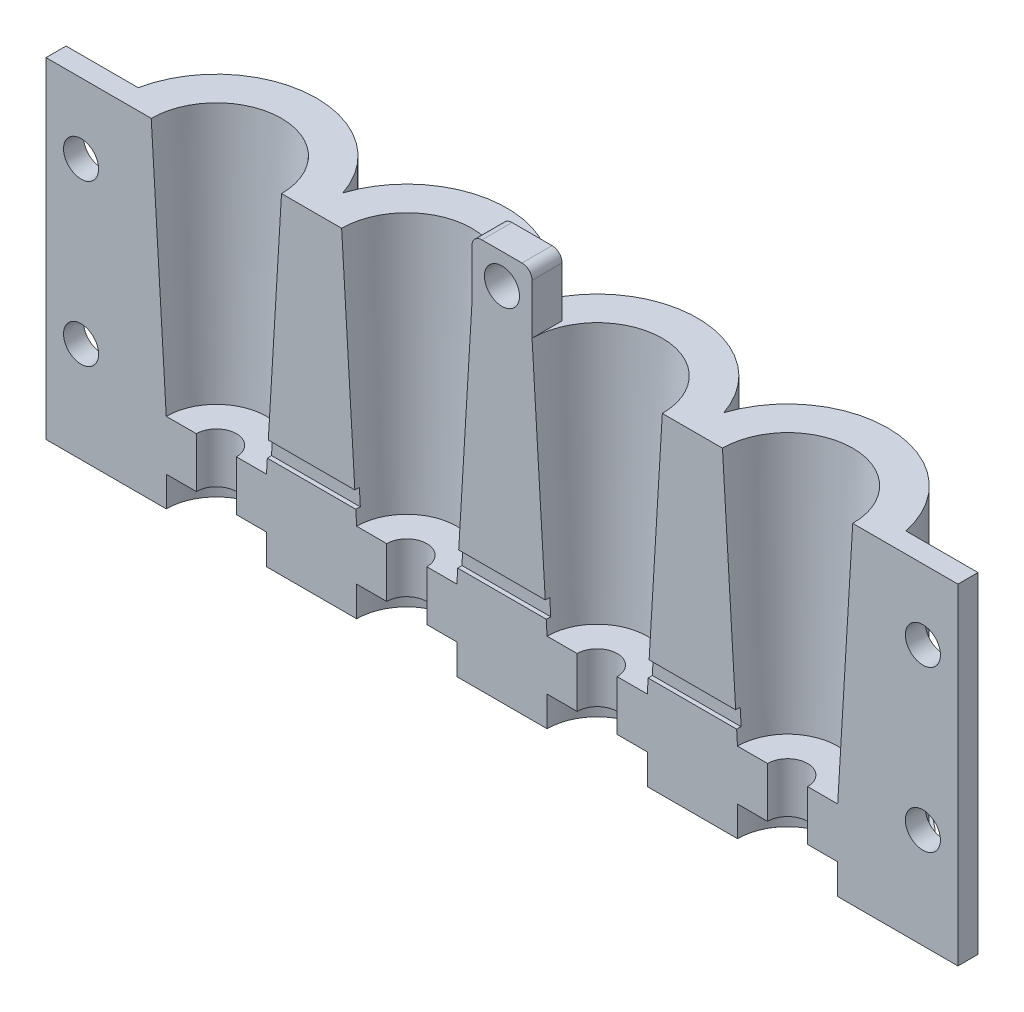
from build123d import *

# Parameters (mm, degrees)
BOSS_EXTRUDE1_DEPTH   = 30
SKETCH4_R             = 2
CUT_EXTRUDE1_DEPTH    = 10
LPATTERN9_COUNT       = 4
LPATTERN9_PITCH       = 19
SKETCH5_W             = 9.377010815
SKETCH5_H             = 30
BOSS_EXTRUDE2_DEPTH   = 2
SKETCH5_W_2           = 8.706514496
BOSS_EXTRUDE2_2_DEPTH = 2
SKETCH6_R             = 1.75
CUT_EXTRUDE2_DEPTH    = 81.473598155
BOSS_EXTRUDE4_DEPTH   = 3
SKETCH10_W            = 1.262251727
SKETCH10_H            = 1.617260026
CUT_EXTRUDE3_DEPTH    = 55
SKETCH11_R            = 1.75
BOSS_EXTRUDE5_DEPTH   = 3


# Read off the part's stored shape, not the designer's step: Boundary-Cut1
with BuildPart() as part:
    # Sketch1 → Boss-Extrude1 (new body)
    with BuildSketch(Plane(origin=(0, 0, 0), x_dir=(1, 0, 0), z_dir=(0, 1, 0))):
        with BuildLine():
            Line((-10, 0), (10, 0))
            ThreePointArc((10, 0), (0, 10), (-10, 0))
        make_face()
    boss_extrude1 = extrude(amount=BOSS_EXTRUDE1_DEPTH)

    # Boundary-Cut1 outline → Boundary-Cut1 (revolve, cut)
    with BuildSketch(Plane.XY):
        Polygon((0, 30.000006646), (0, 5), (5, 5), (6.500000399, 30.000006646), align=None)
    boundary_cut1 = revolve(axis=Axis((0, 0, 0), (0, 1, 0)), mode=Mode.SUBTRACT)

    # Sketch4 → Cut-Extrude1 (cut)
    with BuildSketch(Plane(origin=(0, 5, 0), x_dir=(1, 0, 0), z_dir=(0, 1, 0))):
        Circle(SKETCH4_R)
    cut_extrude1 = extrude(amount=-CUT_EXTRUDE1_DEPTH, mode=Mode.SUBTRACT)

    # LPattern9: Boss-Extrude1, Boundary-Cut1, Cut-Extrude1 ×4
    with Locations(*[(i * LPATTERN9_PITCH, 0, 0) for i in range(1, LPATTERN9_COUNT)]):
        add(boss_extrude1)
        add(boundary_cut1, mode=Mode.SUBTRACT)
        add(cut_extrude1, mode=Mode.SUBTRACT)



with BuildPart() as body_2:
    # Sketch5 → Boss-Extrude2 (new body)
    with BuildSketch(Plane.XY):
        with Locations((-12.311494593, 15)):
            Rectangle(SKETCH5_W, SKETCH5_H)
    extrude(amount=-BOSS_EXTRUDE2_DEPTH)


with BuildPart() as body_3:
    # Sketch5 → Boss-Extrude2 2 (new body)
    with BuildSketch(Plane.XY):
        with Locations((69.646742752, 15)):
            Rectangle(SKETCH5_W_2, SKETCH5_H)
    extrude(amount=-BOSS_EXTRUDE2_2_DEPTH)


with BuildPart() as cut_extrude2_tool:
    # Sketch6 → Cut-Extrude2 (new, through all)
    with BuildSketch(Plane.XY):
        with Locations((-13.5, 23)):
            Circle(SKETCH6_R)
        with Locations((-13.5, 7)):
            Circle(SKETCH6_R)
        with Locations((70.5, 23)):
            Circle(SKETCH6_R)
        with Locations((70.5, 7)):
            Circle(SKETCH6_R)
    extrude(amount=-CUT_EXTRUDE2_DEPTH)


with BuildPart() as body_2_1:
    add(body_2.part)

    # Cut-Extrude2: cut by cut_extrude2_tool
    add(cut_extrude2_tool.part, mode=Mode.SUBTRACT)


with BuildPart() as body_3_1:
    add(body_3.part)

    # Cut-Extrude2: cut by cut_extrude2_tool
    add(cut_extrude2_tool.part, mode=Mode.SUBTRACT)


with BuildPart() as part_1:
    add(part.part)

    add(body_2_1.part)  # Boss-Extrude4 merges body 2

    add(body_3_1.part)  # Boss-Extrude4 merges body 3
    # Sketch9 → Boss-Extrude4 (add)
    with BuildSketch(Plane.XZ):
        with BuildLine():
            Line((5, 0), (14, 0))
            ThreePointArc((14, 0), (19, -5), (24, 0))
            Line((24, 0), (33, 0))
            ThreePointArc((33, 0), (38, -5), (43, 0))
            Line((43, 0), (52, 0))
            ThreePointArc((52, 0), (57, -5), (62, 0))
            Line((62, 0), (67, 0))
            Line((67, 0), (74, 0))
            Line((74, 0), (74, -2))
            Line((74, -2), (66.94427191, -2))
            ThreePointArc((66.94427191, -2), (64, -7.708203932), (58, -10))
            Line((58, -10), (-1, -10))
            ThreePointArc((-1, -10), (-7, -7.708203932), (-9.94427191, -2))
            Line((-9.94427191, -2), (-17, -2))
            Line((-17, -2), (-17, 0))
            Line((-17, 0), (-10, 0))
            Line((-10, 0), (-5, 0))
            ThreePointArc((-5, 0), (0, -5), (5, 0))
        make_face()
    extrude(amount=BOSS_EXTRUDE4_DEPTH)

    # Sketch10 → Cut-Extrude3 (cut)
    with BuildSketch(Plane(origin=(0, 0, 0), x_dir=(0, 0, -1), z_dir=(1, 0, 0))):
        with Locations((-0.197226833, 7.234540745)):
            Rectangle(SKETCH10_W, SKETCH10_H)
    extrude(amount=CUT_EXTRUDE3_DEPTH, mode=Mode.SUBTRACT)

    # Sketch11 → Boss-Extrude5 (add)
    with BuildSketch(Plane.XY):
        with BuildLine():
            Line((25.500111158, 30), (31.499888841, 30))
            Line((31.499888841, 30), (31.499888841, 35))
            ThreePointArc((31.499888841, 35), (31.206995622, 35.707106781), (30.499888841, 36))
            Line((30.499888841, 36), (26.500111158, 36))
            ThreePointArc((26.500111158, 36), (25.793004377, 35.707106781), (25.500111158, 35))
            Line((25.500111158, 35), (25.500111158, 30))
        make_face()
        with Locations((28.5, 33)):
            Circle(SKETCH11_R, mode=Mode.SUBTRACT)
    extrude(amount=-BOSS_EXTRUDE5_DEPTH)


solid = part_1.part
